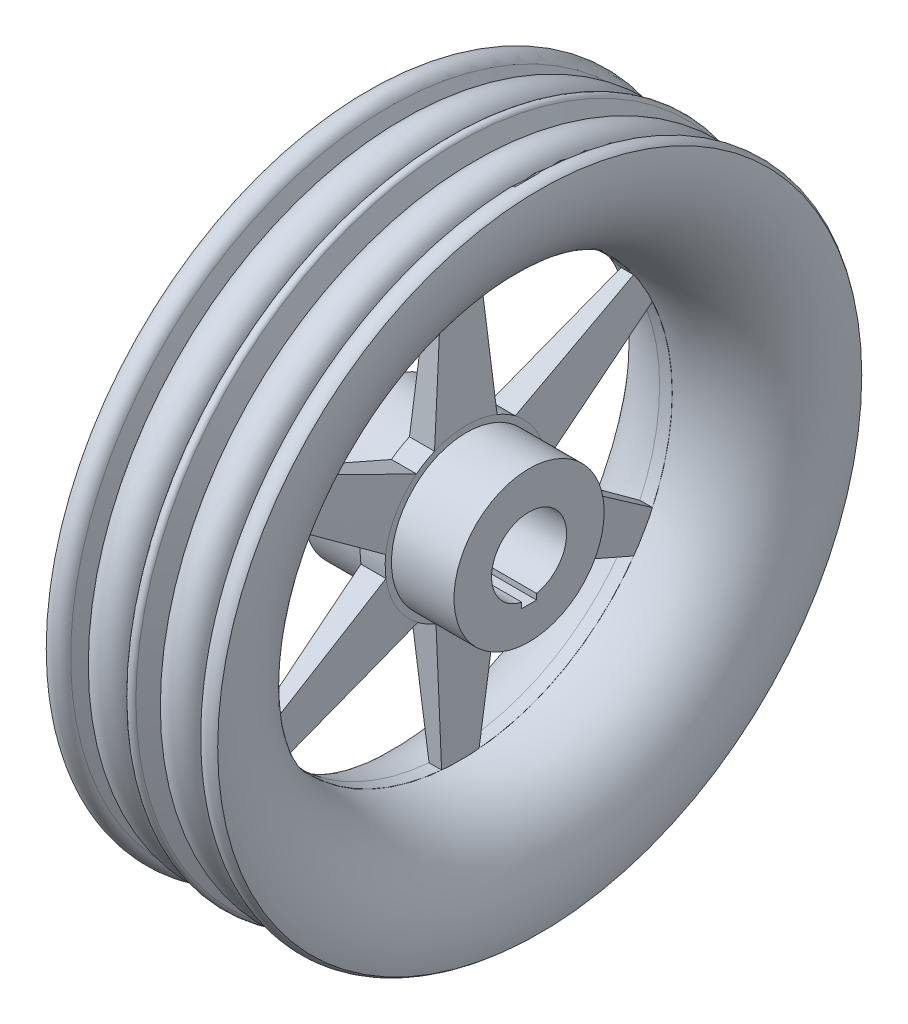
from build123d import *

# Parameters (mm, degrees)
REVOLVE1_2_OUTLINE_R = 8.31225189
REVOLVE1_3_OUTLINE_R = 8.31225189
CUT_EXTRUDE1_DEPTH   = 100
CUT_EXTRUDE2_DEPTH   = 15


# Read off the part's stored shape, not the designer's step: Revolve1
with BuildPart() as part:
    # Revolve1 outline → Revolve1 (revolve)
    with BuildSketch(Plane.YX):
        with BuildLine():
            Line((32.5, 5), (30, 5))
            Line((30, 5), (30, 30))
            Line((30, 30), (15, 30))
            Line((15, 30), (15, -30))
            Line((15, -30), (30, -30))
            Line((30, -30), (30, -5))
            Line((30, -5), (32.5, -5))
            Line((32.5, -5), (84.659716126, -2.5))
            ThreePointArc((84.659716126, -2.5), (84.703936045, -2.499608889), (84.748142128, -2.498435679))
            ThreePointArc((84.748142128, -2.498435679), (99.297079596, -28.641311964), (128.683955461, -34.256745056))
            ThreePointArc((128.683955461, -34.256745056), (129.881869014, -29.795700711), (126.913417162, -26.256745056))
            Line((126.913417162, -26.256745056), (107.200809041, -18.091515422))
            ThreePointArc((107.200809041, -18.091515422), (104.73154277, -14.395997292), (107.200809041, -10.700479162))
            Line((107.200809041, -10.700479162), (128.838918965, -1.737680567))
            ThreePointArc((128.838918965, -1.737680567), (130, 0), (128.838918965, 1.737680567))
            Line((128.838918965, 1.737680567), (107.200809041, 10.700479162))
            ThreePointArc((107.200809041, 10.700479162), (104.73154277, 14.395997292), (107.200809041, 18.091515422))
            Line((107.200809041, 18.091515422), (126.913417162, 26.256745056))
            ThreePointArc((126.913417162, 26.256745056), (129.881869014, 29.795700711), (128.683955461, 34.256745056))
            ThreePointArc((128.683955461, 34.256745056), (99.297079596, 28.641311964), (84.748142128, 2.498435679))
            ThreePointArc((84.748142128, 2.498435679), (84.703936045, 2.499608889), (84.659716126, 2.5))
            Line((84.659716126, 2.5), (32.5, 5))
        make_face()
    revolve(axis=Axis((0, 0, 0), (1, 0, 0)))

    # Sketch2 → Cut-Extrude1 (cut)
    with BuildSketch(Plane(origin=(30, 0, 0), x_dir=(0, 0, -1), z_dir=(1, 0, 0))):
        Polygon((2.999999999999999, -16.999999999999986), (-3.000000000000001, -16.999999999999986), (-3.000000000000001, -12.999999999999988), (2.9999999999999996, -12.999999999999988), align=None)
    extrude(amount=-CUT_EXTRUDE1_DEPTH, mode=Mode.SUBTRACT)

    # Sketch3 → Cut-Extrude2 (cut, symmetric)
    with BuildSketch(Plane(origin=(0, 0, 0), x_dir=(0, 0, -1), z_dir=(1, 0, 0))):
        with BuildLine():
            ThreePointArc((69.26048134401366, 48.685246827018176), (42.301667194947335, 73.33373362334733), (7.467579021713476, 84.32972665772498))
            Line((7.467579021713475, 84.32972665772498), (12.21037120426262, 30.119044391449613))
            ThreePointArc((12.21037120426262, 30.119044391449613), (15.977512424985148, 28.30139743386258), (19.48001017062715, 26.01498037193688))
            Line((19.480010170627153, 26.014980371936886), (69.26048134401366, 48.68524682701819))
        make_face()
        with BuildLine():
            ThreePointArc((84.65971612645619, 0), (82.66259995940923, 18.280101273319648), (76.76547509064443, 35.69775019129071))
            Line((76.76547509064443, 35.69775019129071), (32.18904318283791, 4.485030543195318))
            ThreePointArc((32.1890431828379, 4.4850305431953155), (32.42216759751135, 2.2478986362564504), (32.49999999999997, 0))
            ThreePointArc((32.49999999999997, -7.96e-15), (32.442358625775356, -1.9347782293010707), (32.26963896636445, -3.8626934877739956))
            Line((32.26963896636446, -3.8626934877739814), (76.79290121372023, -35.6387129087451))
            ThreePointArc((76.79290121372021, -35.638712908745106), (82.6696218447039, -18.248319338114413), (84.65971612645619, -2.074e-14))
        make_face()
        with BuildLine():
            ThreePointArc((7.532419869706238, -84.32395973576313), (42.358042674705814, -73.30118522493308), (69.29789606893063, -48.631976466434466))
            Line((69.29789606893067, -48.63197646643444), (19.978671978575164, -25.634013848254327))
            ThreePointArc((19.97867197857515, -25.63401384825432), (16.520972927832002, -27.98763036625002), (12.789628795737157, -29.87767385971085))
            Line((12.789628795737176, -29.87767385971084), (7.532419869706268, -84.32395973576313))
        make_face()
        with BuildLine():
            Line((-19.480010170627324, -26.01498037193674), (-69.26048134401398, -48.68524682701769))
            ThreePointArc((-69.26048134401401, -48.68524682701767), (-42.30166719494786, -73.33373362334703), (-7.467579021714105, -84.32972665772492))
            Line((-7.4675790217140605, -84.32972665772492), (-12.210371204262827, -30.11904439144952))
            ThreePointArc((-12.210371204262831, -30.119044391449528), (-15.977512424985353, -28.301397433862462), (-19.480010170627317, -26.01498037193675))
        make_face()
        with BuildLine():
            Line((-32.269638966364425, 3.8626934877742016), (-76.79290121371997, 35.638712908745624))
            ThreePointArc((-76.79290121371996, 35.638712908745646), (-84.6597098696535, -0.03254839841369005), (-76.76547509064468, -35.697750191290154))
            Line((-76.76547509064468, -35.69775019129015), (-32.18904318283794, -4.485030543195085))
            ThreePointArc((-32.189043182837935, -4.485030543195087), (-32.4984853528173, -0.3137670676123303), (-32.26963896636442, 3.8626934877742065))
        make_face()
        with BuildLine():
            Line((-12.78962879573738, 29.877673859710754), (-7.532419869706854, 84.32395973576307))
            ThreePointArc((-7.532419869706847, 84.32395973576307), (-42.35804267470582, 73.30118522493306), (-69.29789606893029, 48.63197646643494))
            Line((-69.2978960689303, 48.631976466434914), (-19.978671978574976, 25.634013848254458))
            ThreePointArc((-19.978671978574976, 25.634013848254455), (-16.520972927832005, 27.987630366250016), (-12.78962879573738, 29.877673859710754))
        make_face()
    extrude(amount=CUT_EXTRUDE2_DEPTH, both=True, mode=Mode.SUBTRACT)


with BuildPart() as body_2:
    # Revolve1 2 outline → Revolve1 2 (revolve)
    with BuildSketch(Plane.YX):
        with Locations((120, -14.395997292)):
            Circle(REVOLVE1_2_OUTLINE_R)
    revolve(axis=Axis((0, 0, 0), (1, 0, 0)))


with BuildPart() as body_3:
    # Revolve1 3 outline → Revolve1 3 (revolve)
    with BuildSketch(Plane.YX):
        with Locations((120, 14.395997292)):
            Circle(REVOLVE1_3_OUTLINE_R)
    revolve(axis=Axis((0, 0, 0), (1, 0, 0)))


solid = Compound([part.part, body_2.part, body_3.part])
